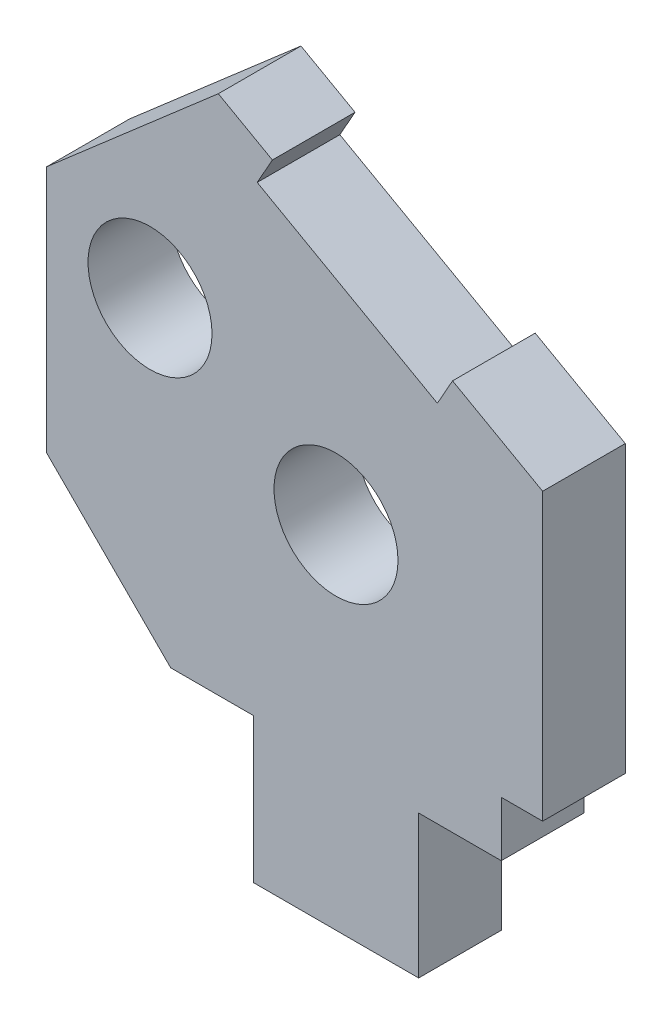
from build123d import *

# Parameters (mm, degrees)
SKETCH_1_R      = 3
EXTRUDE_1_DEPTH = 4
CHAMFER_1_SIZE  = 6


with BuildPart() as part:
    # 草图1 → 凸台-拉伸1 (new body)
    with BuildSketch(Plane.XY):
        Polygon((-10, 25), (-1.694756853, 32.21269272), (0.921035956, 30.743806073), (0.186592632, 29.435909669), (8.905901995, 24.539620846), (9.640345319, 25.84751725), (14, 23.399372839), (14, 9.572691833), (12, 9.572691833), (12, 6.915051809), (8, 6.915051809), (8, 0), (0, 0), (0, 7), (-4, 7), (-4, 13), (-10, 13), align=None)
        with Locations((-5, 22)):
            Circle(SKETCH_1_R, mode=Mode.SUBTRACT)
        with Locations((4, 17)):
            Circle(SKETCH_1_R, mode=Mode.SUBTRACT)
    extrude(amount=EXTRUDE_1_DEPTH)

    # 倒角1
    chamfer_1_edges = [part.edges().sort_by_distance(p)[0] for p in [
        (-4, 13, 2),
    ]]
    chamfer(chamfer_1_edges, length=CHAMFER_1_SIZE - 0.0001)  # a hair under: the kernel refuses the full size


solid = part.part
